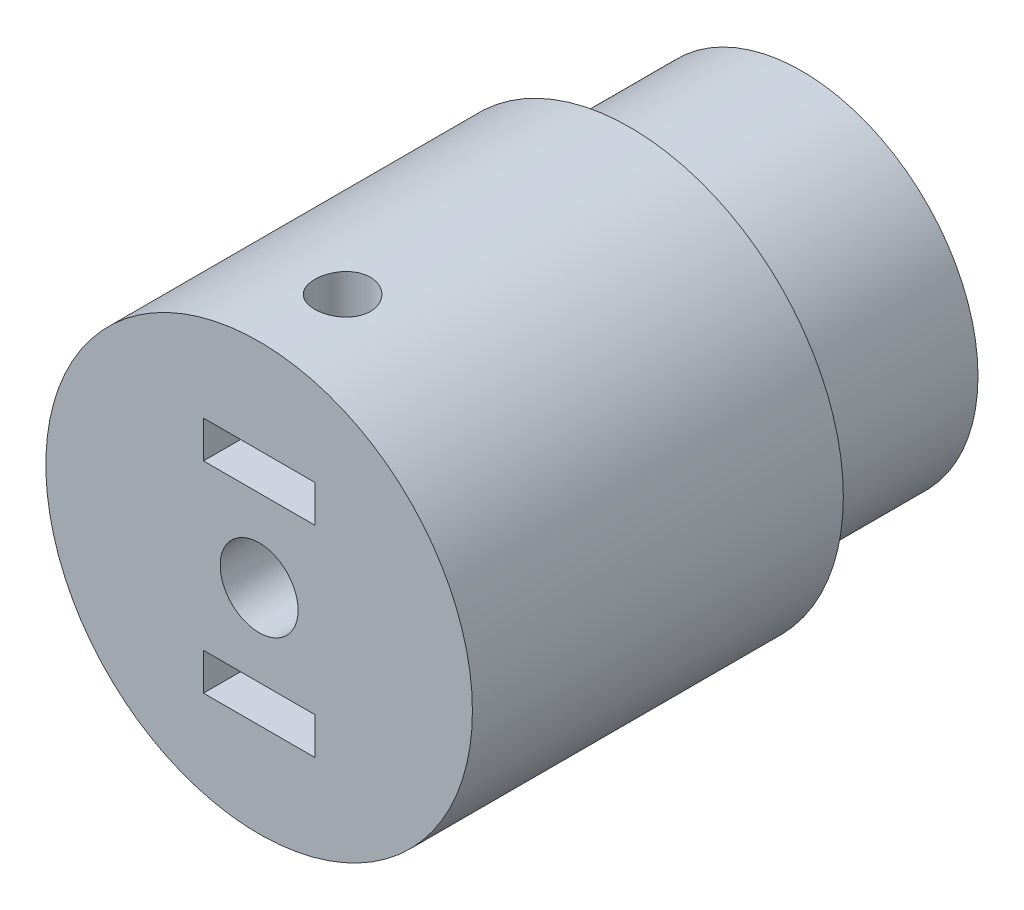
from build123d import *

# Parameters (mm, degrees)
SKETCH1_R                 = 9.5
SKETCH1_R_2               = 2.1
BOSS_EXTRUDE1_DEPTH       = 9.26
BOSS_EXTRUDE2_OUTLINE_R   = 11.5
BOSS_EXTRUDE2_OUTLINE_R_2 = 2.1
BOSS_EXTRUDE2_DEPTH       = 20
SKETCH3_W                 = 6
SKETCH3_H                 = 2
CUT_EXTRUDE1_DEPTH        = 12
SKETCH4_R                 = 1.5
CUT_EXTRUDE2_DEPTH        = 39.953788006
SKETCH5_R                 = 1.5
CUT_EXTRUDE3_DEPTH        = 12


# Read off the part's stored shape, not the designer's step: Boss-Extrude2
with BuildPart() as part:
    # Sketch1 → Boss-Extrude1 (new body)
    with BuildSketch(Plane.XY):
        Circle(SKETCH1_R)
        Circle(SKETCH1_R_2, mode=Mode.SUBTRACT)
    extrude(amount=BOSS_EXTRUDE1_DEPTH)

    # Boss-Extrude2 outline → Boss-Extrude2 (add)
    with BuildSketch(Plane.XY.offset(9.26)):
        Circle(BOSS_EXTRUDE2_OUTLINE_R)
        Circle(BOSS_EXTRUDE2_OUTLINE_R_2, mode=Mode.SUBTRACT)
    extrude(amount=BOSS_EXTRUDE2_DEPTH)

    # Sketch3 → Cut-Extrude1 (cut)
    with BuildSketch(Plane.XY.offset(29.26)):
        with Locations((0, 5.422033923)):
            Rectangle(SKETCH3_W, SKETCH3_H)
        with Locations((0, -5.422033923)):
            Rectangle(SKETCH3_W, SKETCH3_H)
    extrude(amount=-CUT_EXTRUDE1_DEPTH, mode=Mode.SUBTRACT)

    # Sketch4 → Cut-Extrude2 (cut, through all)
    with BuildSketch(Plane(origin=(0, 11.5, 0), x_dir=(1, 0, 0), z_dir=(0, 1, 0))):
        with Locations(Location((0, -24.76, 0), (0, 0, 180))):
            Circle(SKETCH4_R)
    extrude(amount=-CUT_EXTRUDE2_DEPTH, mode=Mode.SUBTRACT)

    # Sketch5 → Cut-Extrude3 (cut)
    with BuildSketch(Plane(origin=(0, 0, 0), x_dir=(-1, 0, 0), z_dir=(0, 0, -1))):
        with Locations((0, 6)):
            Circle(SKETCH5_R)
        with Locations((5.196152423, -3)):
            Circle(SKETCH5_R)
        with Locations((-5.196152423, -3)):
            Circle(SKETCH5_R)
    extrude(amount=-CUT_EXTRUDE3_DEPTH, mode=Mode.SUBTRACT)


solid = part.part
